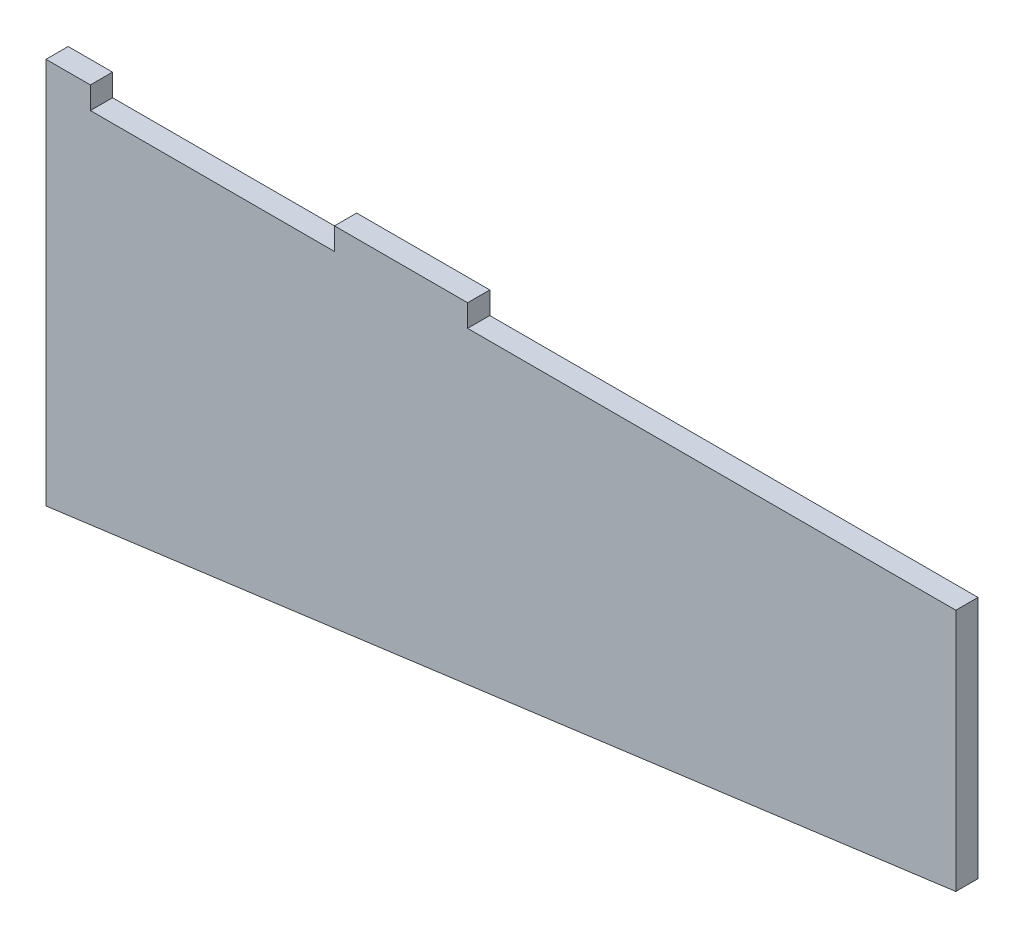
from build123d import *

# Parameters (mm, degrees)
BOSS_EXTRUDE1_DEPTH = 6.35


with BuildPart() as part:
    # Sketch1 → Boss-Extrude1 (new body)
    with BuildSketch(Plane.XY):
        Polygon((0, 0), (12.7, 0), (12.7, -6.35), (82.55, -6.35), (82.55, 0), (120.65, 0), (120.65, -6.35), (203.2, -6.35), (260.35, -6.35), (260.35, -76.064345207), (0, -110.694166386), align=None)
    extrude(amount=BOSS_EXTRUDE1_DEPTH)


solid = part.part
